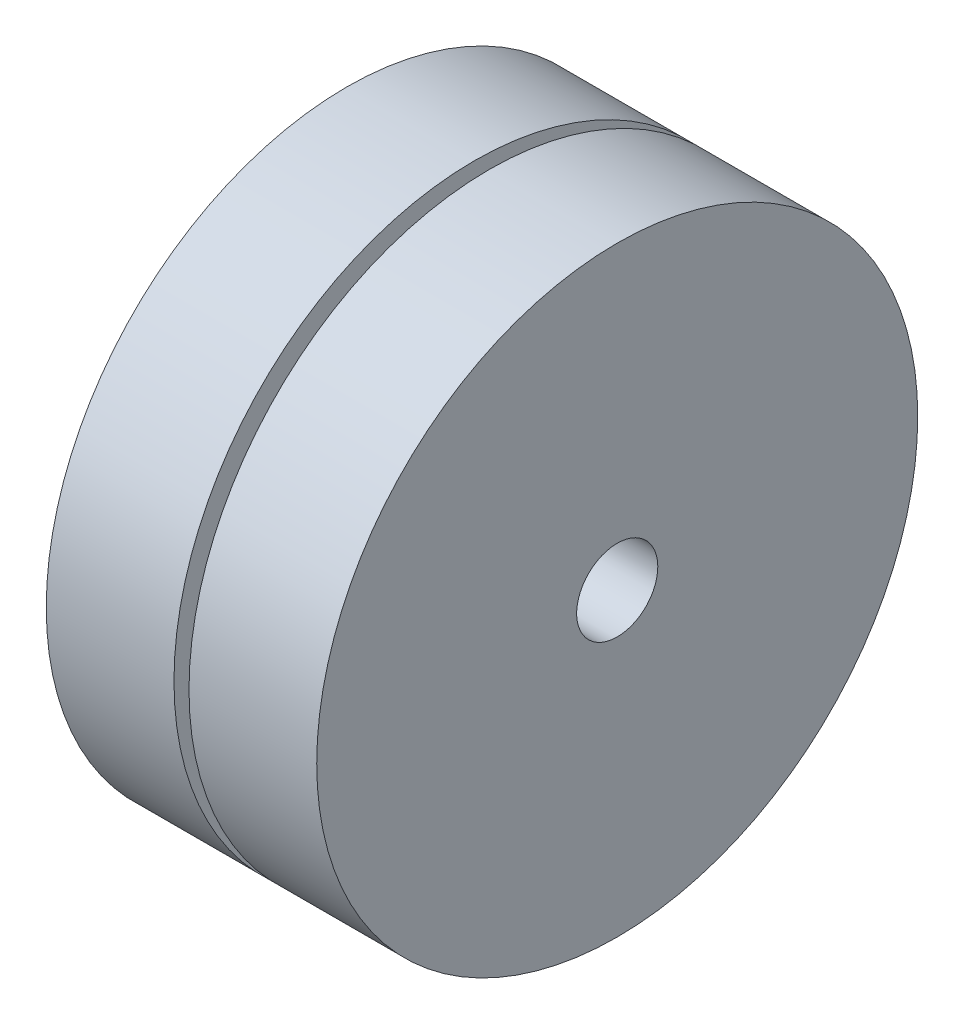
from build123d import *

# Parameters (mm, degrees)
SKETCH1_R           = 20
BOSS_EXTRUDE1_DEPTH = 18
SKETCH2_R           = 2.7
CUT_EXTRUDE1_DEPTH  = 18


with BuildPart() as part:
    # Sketch1 → Boss-Extrude1 (new body)
    with BuildSketch(Plane(origin=(0, 0, 0), x_dir=(0, 0, -1), z_dir=(1, 0, 0))):
        Circle(SKETCH1_R)
    extrude(amount=BOSS_EXTRUDE1_DEPTH)

    # Sketch2 → Cut-Extrude1 (cut)
    with BuildSketch(Plane(origin=(18, 0, 0), x_dir=(0, 0, -1), z_dir=(1, 0, 0))):
        Circle(SKETCH2_R)
    extrude(amount=-CUT_EXTRUDE1_DEPTH, mode=Mode.SUBTRACT)

    # Sketch3 → Cut-Revolve1 (revolve, cut)
    with BuildSketch(Plane.XY):
        with BuildLine():
            Line((9.5, 12.33250833), (9.5, 31.976747139))
            Line((9.5, 31.976747139), (8.5, 31.976747139))
            Line((8.5, 31.976747139), (8.5, 12.33250833))
            ThreePointArc((8.5, 12.33250833), (9, 11.83250833), (9.5, 12.33250833))
        make_face()
    revolve(axis=Axis((0, 0, 0), (1, 0, 0)), mode=Mode.SUBTRACT)


solid = part.part
